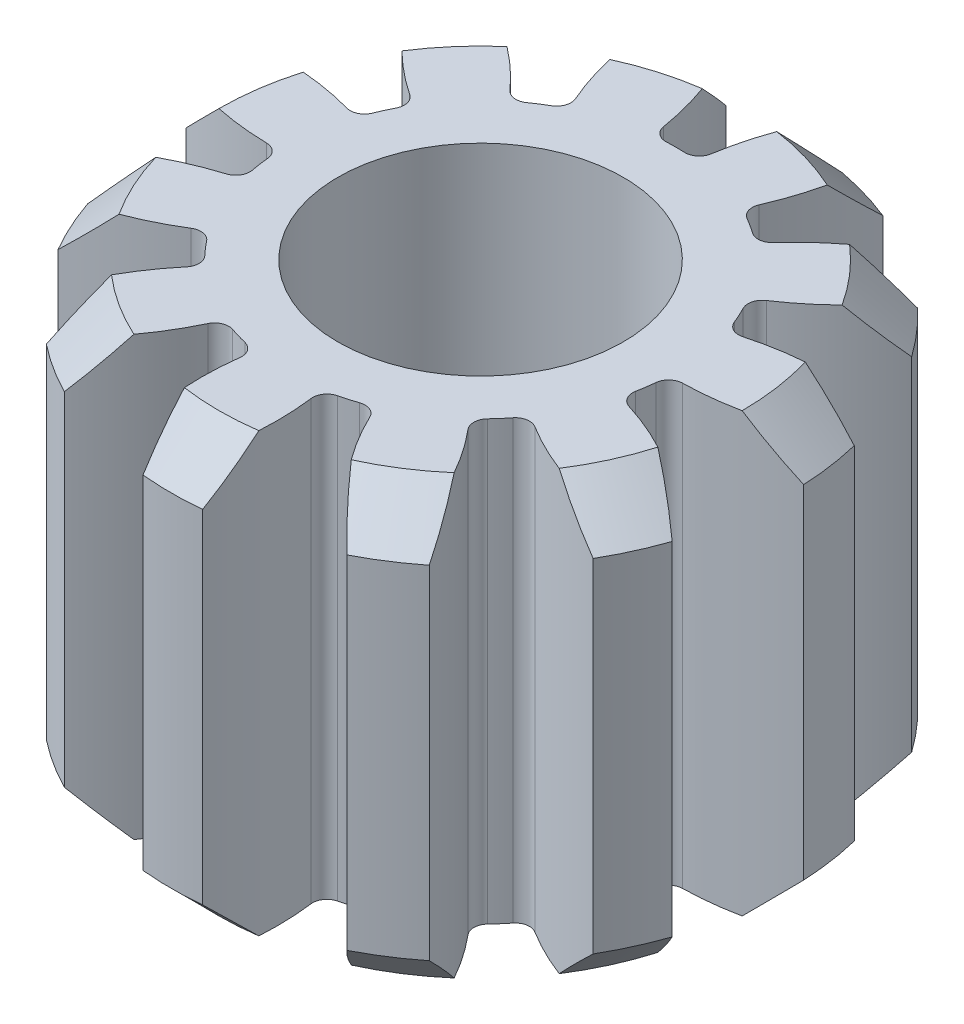
from build123d import *

# Parameters (mm, degrees)
SKETCH1_R                = 1.625
BOSS_EXTRUDE1_DEPTH      = 2.3
CUT_EXTRUDE1_DEPTH       = 4.251345875
FILLET1_R                = 0.075
CHAMFER1_SIZE            = 0.25
CIRPATTERN2_COUNT        = 11
FILLET1_OF_CIRPATTERN2_R = 0.075
SKETCH3_R                = 0.75
CUT_EXTRUDE2_DEPTH       = 4.250481236


with BuildPart() as part:
    # Sketch1 → Boss-Extrude1 (new body)
    with BuildSketch(Plane(origin=(0, 0, 0), x_dir=(1, 0, 0), z_dir=(0, 1, 0))):
        Circle(SKETCH1_R)
    extrude(amount=BOSS_EXTRUDE1_DEPTH)

    # Sketch2 → Cut-Extrude1 (cut, through all)
    with BuildSketch(Plane(origin=(0, 2.3, 0), x_dir=(1, 0, 0), z_dir=(0, 1, 0))):
        with BuildLine():
            ThreePointArc((-0.115185902, 1.018507343), (-0.180466304, 1.317079011), (-0.305237626, 1.59607487))
            ThreePointArc((-0.305237626, 1.59607487), (0, 1.625), (0.305237626, 1.59607487))
            ThreePointArc((0.305237626, 1.59607487), (0.180466304, 1.317079011), (0.115185902, 1.018507343))
            ThreePointArc((0.115185902, 1.018507343), (0, 1.025), (-0.115185902, 1.018507343))
        make_face()
    cut_extrude1 = extrude(amount=-CUT_EXTRUDE1_DEPTH, mode=Mode.SUBTRACT)

    # Fillet1
    fillet1_edges = [part.edges().sort_by_distance(p)[0] for p in [
        (0.115185902, 1.15, -1.018507343),
        (-0.115185902, 1.15, -1.018507343),
    ]]
    fillet(fillet1_edges, radius=FILLET1_R)

    # Chamfer1
    chamfer1_edges = [part.edges().sort_by_distance(p)[0] for p in [
        (0, 0, 1.625),
        (0, 2.3, 1.625),
    ]]
    chamfer(chamfer1_edges, length=CHAMFER1_SIZE)

    # CirPattern2: Cut-Extrude1 ×11 about axis
    cirpattern2_axis = Axis((0, 2.3, 0), (0, -1, 0))
    for i in range(1, CIRPATTERN2_COUNT):
        add(cut_extrude1.rotate(cirpattern2_axis, i * 360 / CIRPATTERN2_COUNT), mode=Mode.SUBTRACT)

    # Fillet1 of CirPattern2
    fillet1_of_cirpattern2_edges = [part.edges().sort_by_distance(p)[0] for p in [
        (0.647547189, 1.15, -0.794548701),
        (0.453746096, 1.15, -0.919097101),
        (0.97431682, 1.15, -0.31832646),
        (0.878616914, 1.15, -0.527880023),
        (0.991747744, 1.15, 0.258962183),
        (1.02453307, 1.15, 0.030935233),
        (0.694305767, 1.15, 0.754032162),
        (0.845167215, 1.15, 0.57992877),
        (0.176426615, 1.15, 1.009702258),
        (0.397466741, 1.15, 0.944799021),
        (-0.397466741, 1.15, 0.944799021),
        (-0.176426615, 1.15, 1.009702258),
        (-0.845167215, 1.15, 0.57992877),
        (-0.694305767, 1.15, 0.754032162),
        (-1.02453307, 1.15, 0.030935233),
        (-0.991747744, 1.15, 0.258962183),
        (-0.878616914, 1.15, -0.527880023),
        (-0.97431682, 1.15, -0.31832646),
        (-0.453746096, 1.15, -0.919097101),
        (-0.647547189, 1.15, -0.794548701),
    ]]
    fillet(fillet1_of_cirpattern2_edges, radius=FILLET1_OF_CIRPATTERN2_R)

    # Sketch3 → Cut-Extrude2 (cut, through all)
    with BuildSketch(Plane(origin=(0, 2.3, 0), x_dir=(1, 0, 0), z_dir=(0, 1, 0))):
        Circle(SKETCH3_R)
    extrude(amount=-CUT_EXTRUDE2_DEPTH, mode=Mode.SUBTRACT)


solid = part.part
